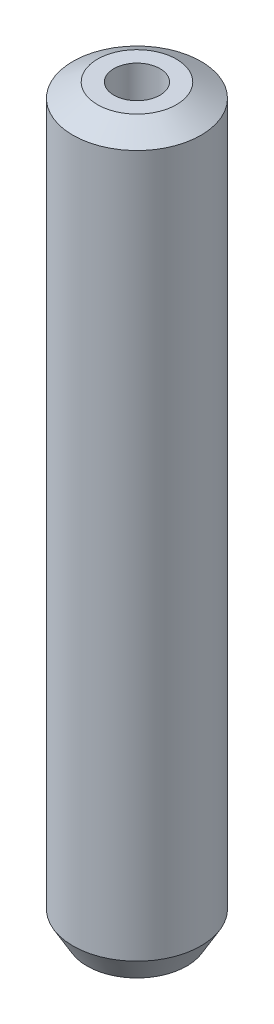
from build123d import *
from OCP.BRepFilletAPI import BRepFilletAPI_MakeChamfer

# Parameters (mm, degrees)
SKETCH1_R           = 7.5
BOSS_EXTRUDE1_DEPTH = 86.757150029
SKETCH2_R           = 2.69998188
CUT_EXTRUDE1_DEPTH  = 88.403106816
CHAMFER1_SIZE       = 1.661488269
CHAMFER1_SIZE2      = 2.877782097


with BuildPart() as part:
    # Sketch1 → Boss-Extrude1 (new body)
    with BuildSketch(Plane(origin=(0, 0, 0), x_dir=(1, 0, 0), z_dir=(0, 1, 0))):
        Circle(SKETCH1_R)
    extrude(amount=BOSS_EXTRUDE1_DEPTH)

    # Sketch2 → Cut-Extrude1 (cut, through all)
    with BuildSketch(Plane(origin=(0, 0, 0), x_dir=(1, 0, 0), z_dir=(0, 1, 0))):
        Circle(SKETCH2_R)
    extrude(amount=CUT_EXTRUDE1_DEPTH, mode=Mode.SUBTRACT)

    # Chamfer1: one chamfer whose edges measure the first distance from different faces: ONE call of the kernel's chamfer builder (chamfer() names one face for all edges)
    chamfer1_edges_1 = [part.edges().sort_by_distance(p)[0] for p in [
        (-7.5, 86.757150029, 0),
    ]]
    chamfer1_side_1 = [part.faces().sort_by_distance(p)[0] for p in [
        (-7.5, 43.378575014, 0),
    ]]
    chamfer1_edges_2 = [part.edges().sort_by_distance(p)[0] for p in [
        (-7.5, 0, 0),
    ]]
    chamfer1_side_2 = [part.faces().sort_by_distance(p)[0] for p in [
        (-7.287867966, 0, 0),
    ]]
    chamfer1 = BRepFilletAPI_MakeChamfer(part.part.solid().wrapped)
    for e in chamfer1_edges_1:
        chamfer1.Add(CHAMFER1_SIZE, CHAMFER1_SIZE2, e.wrapped, chamfer1_side_1[0].wrapped)  # the first distance lies on this face
    for e in chamfer1_edges_2:
        chamfer1.Add(CHAMFER1_SIZE, CHAMFER1_SIZE2, e.wrapped, chamfer1_side_2[0].wrapped)  # the first distance lies on this face
    add(Compound.cast(chamfer1.Shape()), mode=Mode.REPLACE)


solid = part.part
